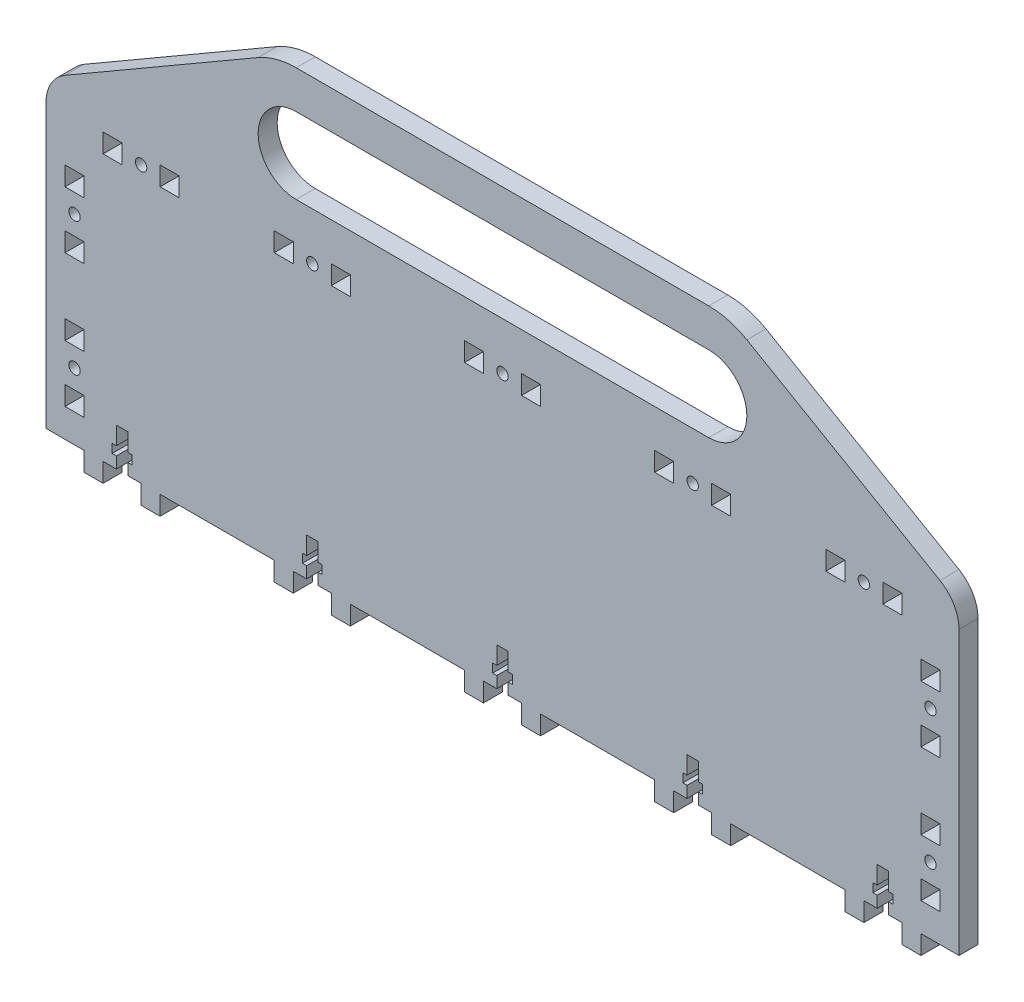
from build123d import *

# Parameters (mm, degrees)
BOSS_EXTRUDE3_OUTLINE_W = 5
BOSS_EXTRUDE3_OUTLINE_H = 5
BOSS_EXTRUDE3_OUTLINE_R = 1.5
BOSS_EXTRUDE3_DEPTH     = 5
FILLET3_R               = 10


# Read off the part's stored shape, not the designer's step: Boss-Extrude3
with BuildPart() as part:
    # Boss-Extrude3 outline → Boss-Extrude3 (new body)
    with BuildSketch(Plane.XY):
        with BuildLine():
            Line((45, 0), (48.5, 0))
            Line((48.5, 0), (48.5, 3))
            Line((48.5, 3), (47.4, 3))
            Line((47.4, 3), (47.4, 5.3))
            Line((47.4, 5.3), (48.5, 5.3))
            Line((48.5, 5.3), (48.5, 10))
            Line((48.5, 10), (51.5, 10))
            Line((51.5, 10), (51.5, 5.3))
            Line((51.5, 5.3), (52.6, 5.3))
            Line((52.6, 5.3), (52.6, 3))
            Line((52.6, 3), (51.5, 3))
            Line((51.5, 3), (51.5, 0))
            Line((51.5, 0), (55, 0))
            Line((55, 0), (55, -5))
            Line((55, -5), (60, -5))
            Line((60, -5), (60, 0))
            Line((60, 0), (90, 0))
            Line((90, 0), (90, -5))
            Line((90, -5), (95, -5))
            Line((95, -5), (95, 0))
            Line((95, 0), (98.5, 0))
            Line((98.5, 0), (98.5, 3))
            Line((98.5, 3), (97.4, 3))
            Line((97.4, 3), (97.4, 5.3))
            Line((97.4, 5.3), (98.5, 5.3))
            Line((98.5, 5.3), (98.5, 10))
            Line((98.5, 10), (101.5, 10))
            Line((101.5, 10), (101.5, 5.3))
            Line((101.5, 5.3), (102.6, 5.3))
            Line((102.6, 5.3), (102.6, 3))
            Line((102.6, 3), (101.5, 3))
            Line((101.5, 3), (101.5, 0))
            Line((101.5, 0), (105, 0))
            Line((105, 0), (105, -5))
            Line((105, -5), (110, -5))
            Line((110, -5), (110, 0))
            Line((110, 0), (120, 0))
            Line((120, 0), (120, 80))
            Line((120, 80), (64.260358304, 112.303991258))
            ThreePointArc((64.260358304, 112.303991258), (59.424115155, 114.314241186), (54.231804742, 115))
            Line((54.231804742, 115), (-54.231804742, 115))
            ThreePointArc((-54.231804742, 115), (-59.424115155, 114.314241186), (-64.260358304, 112.303991258))
            Line((-64.260358304, 112.303991258), (-120, 80))
            Line((-120, 80), (-120, 0))
            Line((-120, 0), (-110, 0))
            Line((-110, 0), (-110, -5))
            Line((-110, -5), (-105, -5))
            Line((-105, -5), (-105, 0))
            Line((-105, 0), (-101.5, 0))
            Line((-101.5, 0), (-101.5, 3))
            Line((-101.5, 3), (-102.6, 3))
            Line((-102.6, 3), (-102.6, 5.3))
            Line((-102.6, 5.3), (-101.5, 5.3))
            Line((-101.5, 5.3), (-101.5, 10))
            Line((-101.5, 10), (-98.5, 10))
            Line((-98.5, 10), (-98.5, 5.3))
            Line((-98.5, 5.3), (-97.4, 5.3))
            Line((-97.4, 5.3), (-97.4, 3))
            Line((-97.4, 3), (-98.5, 3))
            Line((-98.5, 3), (-98.5, 0))
            Line((-98.5, 0), (-95, 0))
            Line((-95, 0), (-95, -5))
            Line((-95, -5), (-90, -5))
            Line((-90, -5), (-90, 0))
            Line((-90, 0), (-60, 0))
            Line((-60, 0), (-60, -5))
            Line((-60, -5), (-55, -5))
            Line((-55, -5), (-55, 0))
            Line((-55, 0), (-51.5, 0))
            Line((-51.5, 0), (-51.5, 3))
            Line((-51.5, 3), (-52.6, 3))
            Line((-52.6, 3), (-52.6, 5.3))
            Line((-52.6, 5.3), (-51.5, 5.3))
            Line((-51.5, 5.3), (-51.5, 10))
            Line((-51.5, 10), (-48.5, 10))
            Line((-48.5, 10), (-48.5, 5.3))
            Line((-48.5, 5.3), (-47.4, 5.3))
            Line((-47.4, 5.3), (-47.4, 3))
            Line((-47.4, 3), (-48.5, 3))
            Line((-48.5, 3), (-48.5, 0))
            Line((-48.5, 0), (-45, 0))
            Line((-45, 0), (-45, -5))
            Line((-45, -5), (-40, -5))
            Line((-40, -5), (-40, 0))
            Line((-40, 0), (-10, 0))
            Line((-10, 0), (-10, -5))
            Line((-10, -5), (-5, -5))
            Line((-5, -5), (-5, 0))
            Line((-5, 0), (-1.5, 0))
            Line((-1.5, 0), (-1.5, 3))
            Line((-1.5, 3), (-2.6, 3))
            Line((-2.6, 3), (-2.6, 5.3))
            Line((-2.6, 5.3), (-1.5, 5.3))
            Line((-1.5, 5.3), (-1.5, 10))
            Line((-1.5, 10), (1.5, 10))
            Line((1.5, 10), (1.5, 5.3))
            Line((1.5, 5.3), (2.6, 5.3))
            Line((2.6, 5.3), (2.6, 3))
            Line((2.6, 3), (1.5, 3))
            Line((1.5, 3), (1.5, 0))
            Line((1.5, 0), (5, 0))
            Line((5, 0), (5, -5))
            Line((5, -5), (10, -5))
            Line((10, -5), (10, 0))
            Line((10, 0), (40, 0))
            Line((40, 0), (40, -5))
            Line((40, -5), (45, -5))
            Line((45, -5), (45, 0))
        make_face()
        with Locations((-112.5, 10)):
            Rectangle(BOSS_EXTRUDE3_OUTLINE_W, BOSS_EXTRUDE3_OUTLINE_H, mode=Mode.SUBTRACT)
        with Locations((-112.5, 17.5)):
            Circle(BOSS_EXTRUDE3_OUTLINE_R, mode=Mode.SUBTRACT)
        with Locations((-112.5, 25)):
            Rectangle(BOSS_EXTRUDE3_OUTLINE_W, BOSS_EXTRUDE3_OUTLINE_H, mode=Mode.SUBTRACT)
        with Locations((-112.5, 45)):
            Rectangle(BOSS_EXTRUDE3_OUTLINE_W, BOSS_EXTRUDE3_OUTLINE_H, mode=Mode.SUBTRACT)
        with Locations((-112.5, 52.5)):
            Circle(BOSS_EXTRUDE3_OUTLINE_R, mode=Mode.SUBTRACT)
        with Locations((112.5, 10)):
            Rectangle(BOSS_EXTRUDE3_OUTLINE_W, BOSS_EXTRUDE3_OUTLINE_H, mode=Mode.SUBTRACT)
        with Locations((112.5, 17.5)):
            Circle(BOSS_EXTRUDE3_OUTLINE_R, mode=Mode.SUBTRACT)
        with Locations((112.5, 25)):
            Rectangle(BOSS_EXTRUDE3_OUTLINE_W, BOSS_EXTRUDE3_OUTLINE_H, mode=Mode.SUBTRACT)
        with Locations((112.5, 45)):
            Rectangle(BOSS_EXTRUDE3_OUTLINE_W, BOSS_EXTRUDE3_OUTLINE_H, mode=Mode.SUBTRACT)
        with Locations((112.5, 52.5)):
            Circle(BOSS_EXTRUDE3_OUTLINE_R, mode=Mode.SUBTRACT)
        with Locations((-112.5, 60)):
            Rectangle(BOSS_EXTRUDE3_OUTLINE_W, BOSS_EXTRUDE3_OUTLINE_H, mode=Mode.SUBTRACT)
        with Locations((-102.5, 72.5)):
            Rectangle(BOSS_EXTRUDE3_OUTLINE_W, BOSS_EXTRUDE3_OUTLINE_H, mode=Mode.SUBTRACT)
        with Locations((-95, 72.5)):
            Circle(BOSS_EXTRUDE3_OUTLINE_R, mode=Mode.SUBTRACT)
        with Locations((-87.5, 72.5)):
            Rectangle(BOSS_EXTRUDE3_OUTLINE_W, BOSS_EXTRUDE3_OUTLINE_H, mode=Mode.SUBTRACT)
        with Locations((-57.5, 72.5)):
            Rectangle(BOSS_EXTRUDE3_OUTLINE_W, BOSS_EXTRUDE3_OUTLINE_H, mode=Mode.SUBTRACT)
        with Locations((-50, 72.5)):
            Circle(BOSS_EXTRUDE3_OUTLINE_R, mode=Mode.SUBTRACT)
        with Locations((-42.5, 72.5)):
            Rectangle(BOSS_EXTRUDE3_OUTLINE_W, BOSS_EXTRUDE3_OUTLINE_H, mode=Mode.SUBTRACT)
        with Locations((-7.5, 72.5)):
            Rectangle(BOSS_EXTRUDE3_OUTLINE_W, BOSS_EXTRUDE3_OUTLINE_H, mode=Mode.SUBTRACT)
        with Locations((0, 72.5)):
            Circle(BOSS_EXTRUDE3_OUTLINE_R, mode=Mode.SUBTRACT)
        with Locations((7.5, 72.5)):
            Rectangle(BOSS_EXTRUDE3_OUTLINE_W, BOSS_EXTRUDE3_OUTLINE_H, mode=Mode.SUBTRACT)
        with Locations((42.5, 72.5)):
            Rectangle(BOSS_EXTRUDE3_OUTLINE_W, BOSS_EXTRUDE3_OUTLINE_H, mode=Mode.SUBTRACT)
        with Locations((50, 72.5)):
            Circle(BOSS_EXTRUDE3_OUTLINE_R, mode=Mode.SUBTRACT)
        with Locations((57.5, 72.5)):
            Rectangle(BOSS_EXTRUDE3_OUTLINE_W, BOSS_EXTRUDE3_OUTLINE_H, mode=Mode.SUBTRACT)
        with Locations((112.5, 60)):
            Rectangle(BOSS_EXTRUDE3_OUTLINE_W, BOSS_EXTRUDE3_OUTLINE_H, mode=Mode.SUBTRACT)
        with Locations((87.5, 72.5)):
            Rectangle(BOSS_EXTRUDE3_OUTLINE_W, BOSS_EXTRUDE3_OUTLINE_H, mode=Mode.SUBTRACT)
        with Locations((95, 72.5)):
            Circle(BOSS_EXTRUDE3_OUTLINE_R, mode=Mode.SUBTRACT)
        with Locations((102.5, 72.5)):
            Rectangle(BOSS_EXTRUDE3_OUTLINE_W, BOSS_EXTRUDE3_OUTLINE_H, mode=Mode.SUBTRACT)
        with BuildLine():
            Line((-54.231804742, 105), (54.231804742, 105))
            ThreePointArc((54.231804742, 105), (64.231804742, 95), (54.231804742, 85))
            Line((54.231804742, 85), (-54.231804742, 85))
            ThreePointArc((-54.231804742, 85), (-64.231804742, 95), (-54.231804742, 105))
        make_face(mode=Mode.SUBTRACT)
    extrude(amount=BOSS_EXTRUDE3_DEPTH)

    # Fillet3
    fillet3_edges = [part.edges().sort_by_distance(p)[0] for p in [
        (-120, 80, 2.5),
        (120, 80, 2.5),
    ]]
    fillet(fillet3_edges, radius=FILLET3_R)


solid = part.part
